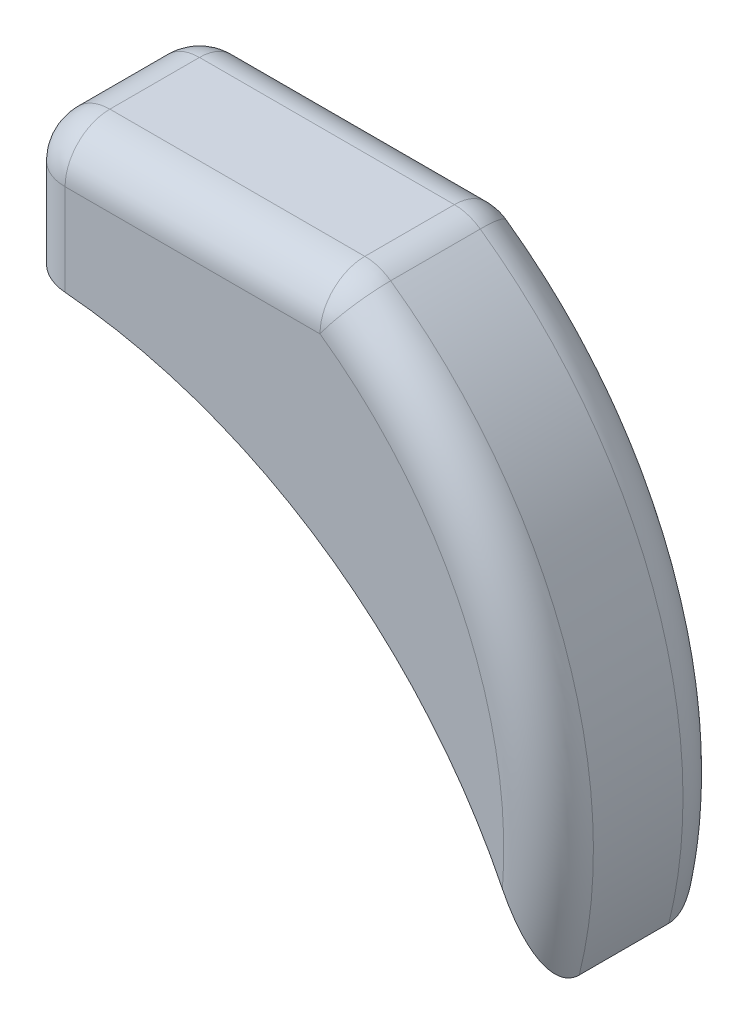
from build123d import *

# Parameters (mm, degrees)
BOSS_EXTRU_1_DEPTH      = 20
CONG_7_R                = 10
ESQUISSE13_R            = 1.5
ENL_V_MAT_EXTRU_1_DEPTH = 15
ENL_V_START             = -5
ESQUISSE13_2_R          = 1.5
ENL_V_MAT_EXTRU_2_DEPTH = 5


with BuildPart() as part:
    # Esquisse1 → Boss.-Extru.1 (new, symmetric)
    with BuildSketch(Plane.XY):
        with BuildLine():
            Line((35, 15), (-35, 15))
            Line((-35, 15), (-35, -15))
            ThreePointArc((-35, -15), (36.414284285, -38.56349239), (79.782402832, -100))
            ThreePointArc((79.782402832, -100), (75.641274878, -35.393198769), (35, 15))
        make_face()
    extrude(amount=BOSS_EXTRU_1_DEPTH, both=True)

    # Congé7
    cong_7_edges = [part.edges().sort_by_distance(p)[0] for p in [
        (75.641274878, -35.393198769, 20),
        (35, 15, 0),
        (0, 15, -20),
        (0, 15, 20),
        (-35, 15, 0),
        (-35, 0, -20),
        (-35, 0, 20),
        (75.641274878, -35.393198769, -20),
    ]]
    fillet(cong_7_edges, radius=CONG_7_R)

    # Esquisse13 → Enlèv. mat.-Extru.1 (cut)
    with BuildSketch(Plane(origin=(26.271304137, -32.617801603, 0), x_dir=(-0.8594367118402864, 0.5112421523516589, 0), z_dir=(-0.5112421523516589, -0.8594367118402864, 0))):
        with Locations((33.115659818, 0)):
            Circle(ESQUISSE13_R)
        with Locations((-42.482234445, 0)):
            Circle(ESQUISSE13_R)
    extrude(amount=ENL_V_MAT_EXTRU_1_DEPTH, mode=Mode.SUBTRACT)

    # Esquisse13<2> → Enlèv. mat.-Extru.2 (cut)
    with BuildSketch(Plane(origin=(26.271304137, -32.617801603, 0), x_dir=(-0.8594367118402864, 0.5112421523516589, 0), z_dir=(-0.5112421523516589, -0.8594367118402864, 0)).offset(ENL_V_START)):
        with Locations((33.115659818, 0)):
            Circle(ESQUISSE13_2_R)
        with Locations((-42.482234445, 0)):
            Circle(ESQUISSE13_2_R)
    extrude(amount=ENL_V_MAT_EXTRU_2_DEPTH, mode=Mode.SUBTRACT)


solid = part.part
